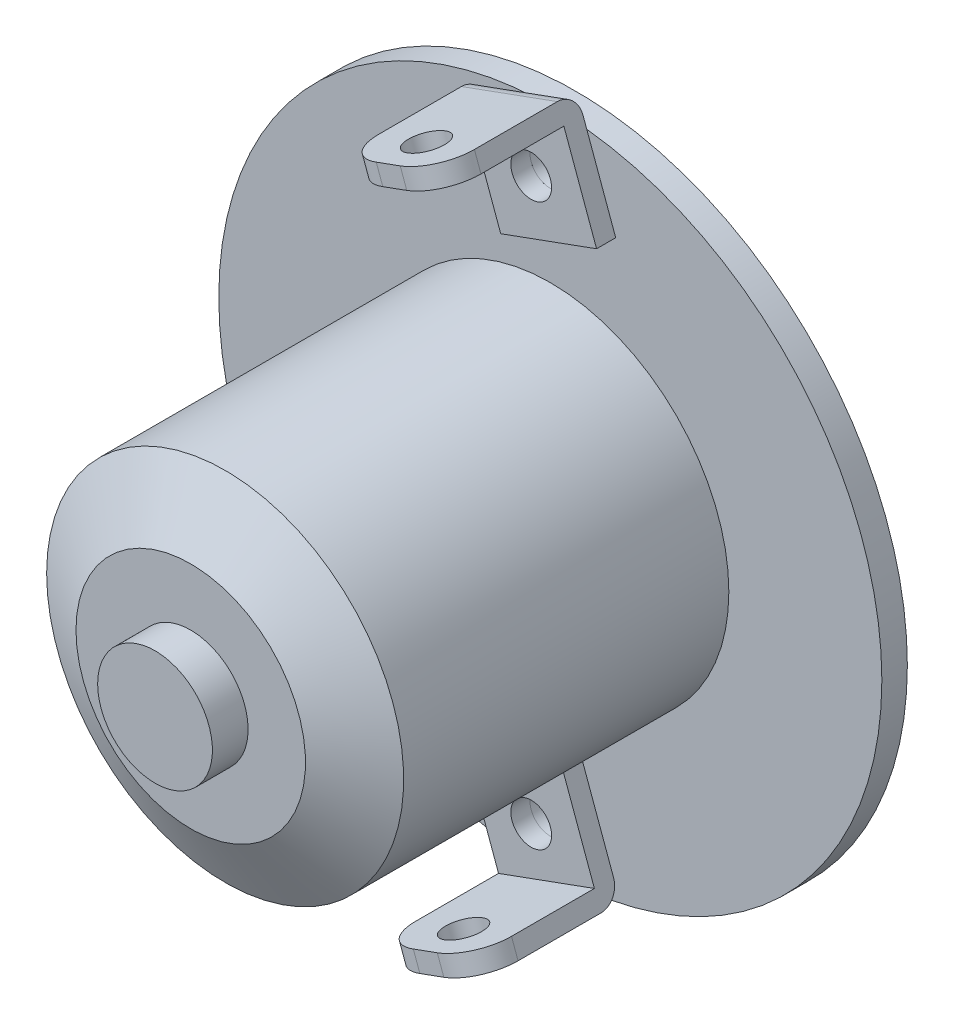
from build123d import *

# Parameters (mm, degrees)
SKICA1_R                        = 26
SKICA1_R_2                      = 3
SKICA1_R_3                      = 1.6
P_IDAT_VYSUNUT_M1_DEPTH         = 2
VYSUNOUT_TENKOST_NN_1_DEPTH     = 4
SKICA4_R                        = 1.6
ODEBRAT_VYSUNUT_M1_DEPTH        = 1.5
SKICA5_R                        = 1.5
ODEBRAT_VYSUNUT_M2_DEPTH        = 1.5
ZAOBLIT1_R                      = 3
T_LO_P_ESUNOUT_KOP_ROVAT1_ANGLE = 20
T_LO_P_ESUNOUT_KOP_ROVAT2_ANGLE = 20


with BuildPart() as part:
    # Skica1 → Přidat vysunutím1 (new body)
    with BuildSketch(Plane.XY):
        Circle(SKICA1_R)
        Circle(SKICA1_R_2, mode=Mode.SUBTRACT)
        with Locations((7, 0)):
            Circle(SKICA1_R_3, mode=Mode.SUBTRACT)
        with Locations((0, 6)):
            Circle(SKICA1_R_3, mode=Mode.SUBTRACT)
        with Locations(Location((0, -6, 0), (0, 0, 180))):
            Circle(SKICA1_R_3, mode=Mode.SUBTRACT)
        with Locations(Location((-7, 0, 0), (0, 0, 180))):
            Circle(SKICA1_R_3, mode=Mode.SUBTRACT)
        with Locations((0, 22)):
            Circle(SKICA1_R_3, mode=Mode.SUBTRACT)
        with Locations(Location((0, -22, 0), (0, 0, 180))):
            Circle(SKICA1_R_3, mode=Mode.SUBTRACT)
    extrude(amount=P_IDAT_VYSUNUT_M1_DEPTH)

    # Skica2 → Rotovat1 (revolve)
    with BuildSketch(Plane(origin=(0, 0, 0), x_dir=(0, 0, -1), z_dir=(1, 0, 0)), mode=Mode.PRIVATE) as rotovat1_sk:
        Polygon((-33, 0), (-33, 4.5), (-30.2, 4.5), (-30.2, 9), (-27.5, 14), (-2, 14), (-2, 2.5), (-0.5, 2.5), (-0.5, 1.5), (9.5, 1.5), (9.5, 0), align=None)
    revolve(rotovat1_sk.sketch.rotate(Axis((0, 0, 0), (0, 0, 1)), 90), axis=Axis((0, 0, 0), (0, 0, 1)))


with BuildPart() as body_2:
    # Skica3 → Vysunout tenkostěnný1 (new, symmetric)
    with BuildSketch(Plane(origin=(0, 0, 0), x_dir=(0, 0, -1), z_dir=(1, 0, 0))):
        with BuildLine():
            Line((-2, 18), (-2, 25.5))
            ThreePointArc((-2, 25.5), (-2.439339828, 26.560660172), (-3.5, 27))
            Line((-3.5, 27), (-13, 27))
            Line((-13, 27), (-13, 25.5))
            Line((-13, 25.5), (-3.5, 25.5))
            Line((-3.5, 25.5), (-3.5, 18))
            Line((-3.5, 18), (-2, 18))
        make_face()
    extrude(amount=VYSUNOUT_TENKOST_NN_1_DEPTH, both=True)

    # Skica4 → Odebrat vysunutím1 (cut)
    with BuildSketch(Plane(origin=(0, 0, 2), x_dir=(-1, 0, 0), z_dir=(0, 0, -1))):
        with Locations((0, 22)):
            Circle(SKICA4_R)
    extrude(amount=-ODEBRAT_VYSUNUT_M1_DEPTH, mode=Mode.SUBTRACT)

    # Skica5 → Odebrat vysunutím2 (cut)
    with BuildSketch(Plane(origin=(0, 27, 0), x_dir=(1, 0, 0), z_dir=(0, 1, 0))):
        with Locations(Location((0, -10, 0), (0, 0, 270))):
            Circle(SKICA5_R)
    extrude(amount=-ODEBRAT_VYSUNUT_M2_DEPTH, mode=Mode.SUBTRACT)

    # Zaoblit1
    zaoblit1_edges = [body_2.edges().sort_by_distance(p)[0] for p in [
        (4, 26.25, 13),
        (-4, 26.25, 13),
    ]]
    fillet(zaoblit1_edges, radius=ZAOBLIT1_R)


with BuildPart() as body_3:
    # Zrcadlit1: mirrored copy
    add(body_2.part.mirror(Plane.ZX))


with BuildPart() as body_2_1:
    # Tělo-Přesunout/kopírovat1: read off the stored shape, not the designer's step
    # Tělo-Přesunout/kopírovat1: moved
    add(body_2.part.moved(Location((7.5244432, -1.3267623, 0))).rotate(Axis((0, 0, 0), (0, 0, 1)), T_LO_P_ESUNOUT_KOP_ROVAT1_ANGLE))


with BuildPart() as body_3_1:
    # Tělo-Přesunout/kopírovat2: read off the stored shape, not the designer's step
    # Tělo-Přesunout/kopírovat2: moved
    add(body_3.part.moved(Location((-7.5244432, 1.3267623, 0))).rotate(Axis((0, 0, 0), (0, 0, 1)), T_LO_P_ESUNOUT_KOP_ROVAT2_ANGLE))


solid = Compound([part.part, body_2_1.part, body_3_1.part])
